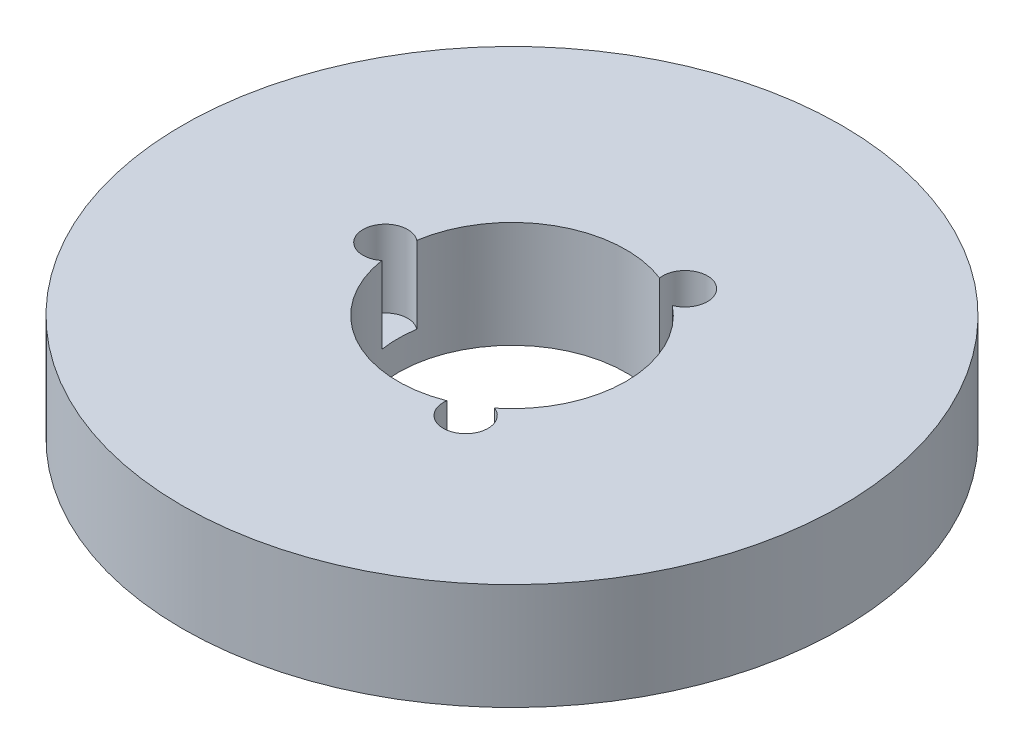
from build123d import *

# Parameters (mm, degrees)
SKETCH1_R           = 65
BOSS_EXTRUDE1_DEPTH = 21
SKETCH2_R           = 22.5
CUT_EXTRUDE1_DEPTH  = 95.292099351
SKETCH3_R           = 4.414114237
CUT_EXTRUDE2_DEPTH  = 15.178209641
CIRPATTERN1_COUNT   = 3


with BuildPart() as part:
    # Sketch1 → Boss-Extrude1 (new body)
    with BuildSketch(Plane(origin=(0, 0, 0), x_dir=(1, 0, 0), z_dir=(0, 1, 0))):
        Circle(SKETCH1_R)
    extrude(amount=BOSS_EXTRUDE1_DEPTH)

    # Sketch2 → Cut-Extrude1 (cut, through all)
    with BuildSketch(Plane(origin=(0, 0, 0), x_dir=(1, 0, 0), z_dir=(0, 1, 0))):
        Circle(SKETCH2_R)
    extrude(amount=CUT_EXTRUDE1_DEPTH, mode=Mode.SUBTRACT)

    # Sketch3 → Cut-Extrude2 (cut)
    with BuildSketch(Plane(origin=(0, 21, 0), x_dir=(1, 0, 0), z_dir=(0, 1, 0))):
        with Locations((-24.984392896, 0)):
            Circle(SKETCH3_R)
    cut_extrude2 = extrude(amount=-CUT_EXTRUDE2_DEPTH, mode=Mode.SUBTRACT)

    # CirPattern1: Cut-Extrude2 ×3 about axis
    cirpattern1_axis = Axis((0, 0, 0), (0, 1, 0))
    for i in range(1, CIRPATTERN1_COUNT):
        add(cut_extrude2.rotate(cirpattern1_axis, i * 360 / CIRPATTERN1_COUNT), mode=Mode.SUBTRACT)


solid = part.part
